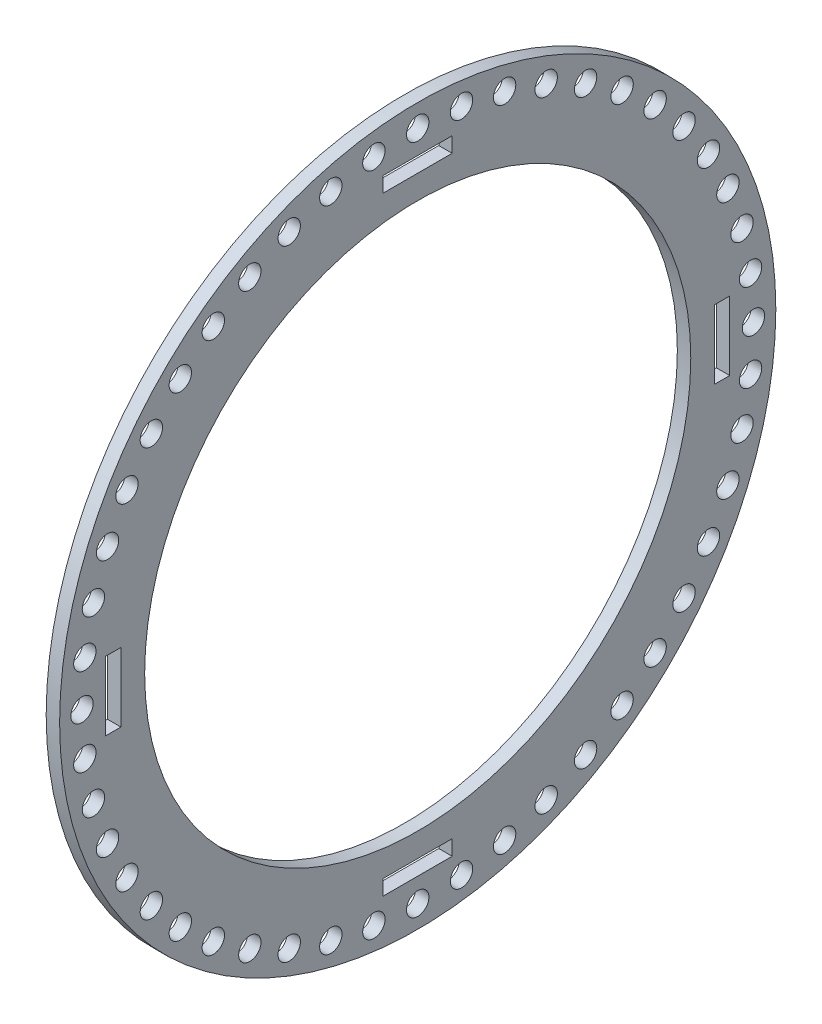
from build123d import *

# Parameters (mm, degrees)
SKETCH1_R           = 40
SKETCH1_R_2         = 30.5
SKETCH1_W           = 7.7
SKETCH1_H           = 1.7
SKETCH1_W_2         = 1.7
SKETCH1_H_2         = 7.7
BOSS_EXTRUDE4_DEPTH = 1.5
SKETCH2_R           = 1.25
CUT_EXTRUDE2_DEPTH  = 1.5
CIRPATTERN3_COUNT   = 48


with BuildPart() as part:
    # Sketch1 → Boss-Extrude4 (new body)
    with BuildSketch(Plane(origin=(0, 0, 0), x_dir=(0, 0, -1), z_dir=(1, 0, 0))):
        Circle(SKETCH1_R)
        Circle(SKETCH1_R_2, mode=Mode.SUBTRACT)
        with Locations((0, 34)):
            Rectangle(SKETCH1_W, SKETCH1_H, mode=Mode.SUBTRACT)
        with Locations((34, 0)):
            Rectangle(SKETCH1_W_2, SKETCH1_H_2, mode=Mode.SUBTRACT)
        with Locations((0, -34)):
            Rectangle(SKETCH1_W, SKETCH1_H, mode=Mode.SUBTRACT)
        with Locations((-34, 0)):
            Rectangle(SKETCH1_W_2, SKETCH1_H_2, mode=Mode.SUBTRACT)
    extrude(amount=BOSS_EXTRUDE4_DEPTH)

    # Sketch2 → Cut-Extrude2 (cut)
    with BuildSketch(Plane(origin=(1.5, 0, 0), x_dir=(0, 0, -1), z_dir=(1, 0, 0))):
        with Locations((0, 37.5)):
            Circle(SKETCH2_R)
    cut_extrude2 = extrude(amount=-CUT_EXTRUDE2_DEPTH, mode=Mode.SUBTRACT)

    # CirPattern3: Cut-Extrude2 ×48 about axis
    cirpattern3_axis = Axis((1.5, 0, 0), (1, 0, 0))
    for i in range(1, CIRPATTERN3_COUNT):
        add(cut_extrude2.rotate(cirpattern3_axis, i * 360 / CIRPATTERN3_COUNT), mode=Mode.SUBTRACT)


solid = part.part
